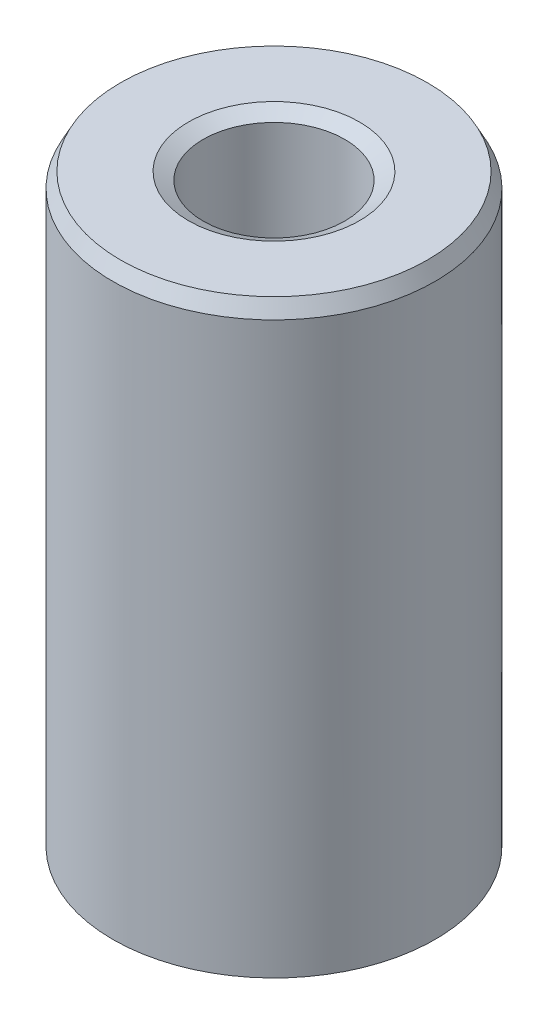
from build123d import *
from OCP.BRepFilletAPI import BRepFilletAPI_MakeChamfer

# Parameters (mm, degrees)
SKETCH1_R           = 15
BOSS_EXTRUDE1_DEPTH = 55.112885182
SKETCH2_R           = 6.590628138
CUT_EXTRUDE1_DEPTH  = 60.054467343
CHAMFER1_SIZE       = 1.369249346
CHAMFER1_SIZE2      = 0.715288436


with BuildPart() as part:
    # Sketch1 → Boss-Extrude1 (new body)
    with BuildSketch(Plane(origin=(0, 0, 0), x_dir=(1, 0, 0), z_dir=(0, 1, 0))):
        Circle(SKETCH1_R)
    extrude(amount=BOSS_EXTRUDE1_DEPTH)

    # Sketch2 → Cut-Extrude1 (cut, through all)
    with BuildSketch(Plane(origin=(0, 0, 0), x_dir=(1, 0, 0), z_dir=(0, 1, 0))):
        Circle(SKETCH2_R)
    extrude(amount=CUT_EXTRUDE1_DEPTH, mode=Mode.SUBTRACT)

    # Chamfer1: one chamfer whose edges measure the first distance from different faces: ONE call of the kernel's chamfer builder (chamfer() names one face for all edges)
    chamfer1_edges_1 = [part.edges().sort_by_distance(p)[0] for p in [
        (-6.590628138, 55.112885182, 0),
    ]]
    chamfer1_side_1 = [part.faces().sort_by_distance(p)[0] for p in [
        (-14.575735931, 55.112885182, 0),
    ]]
    chamfer1_edges_2 = [part.edges().sort_by_distance(p)[0] for p in [
        (-6.590628138, 0, 0),
    ]]
    chamfer1_side_2 = [part.faces().sort_by_distance(p)[0] for p in [
        (-6.590628138, 27.556442591, 0),
    ]]
    chamfer1_edges_3 = [part.edges().sort_by_distance(p)[0] for p in [
        (-15, 0, 0),
    ]]
    chamfer1_side_3 = [part.faces().sort_by_distance(p)[0] for p in [
        (-14.575735931, 0, 0),
    ]]
    chamfer1_edges_4 = [part.edges().sort_by_distance(p)[0] for p in [
        (-15, 55.112885182, 0),
    ]]
    chamfer1_side_4 = [part.faces().sort_by_distance(p)[0] for p in [
        (-15, 27.556442591, 0),
    ]]
    chamfer1 = BRepFilletAPI_MakeChamfer(part.part.solid().wrapped)
    for e in chamfer1_edges_1:
        chamfer1.Add(CHAMFER1_SIZE, CHAMFER1_SIZE2, e.wrapped, chamfer1_side_1[0].wrapped)  # the first distance lies on this face
    for e in chamfer1_edges_2:
        chamfer1.Add(CHAMFER1_SIZE, CHAMFER1_SIZE2, e.wrapped, chamfer1_side_2[0].wrapped)  # the first distance lies on this face
    for e in chamfer1_edges_3:
        chamfer1.Add(CHAMFER1_SIZE, CHAMFER1_SIZE2, e.wrapped, chamfer1_side_3[0].wrapped)  # the first distance lies on this face
    for e in chamfer1_edges_4:
        chamfer1.Add(CHAMFER1_SIZE, CHAMFER1_SIZE2, e.wrapped, chamfer1_side_4[0].wrapped)  # the first distance lies on this face
    add(Compound.cast(chamfer1.Shape()), mode=Mode.REPLACE)


solid = part.part
